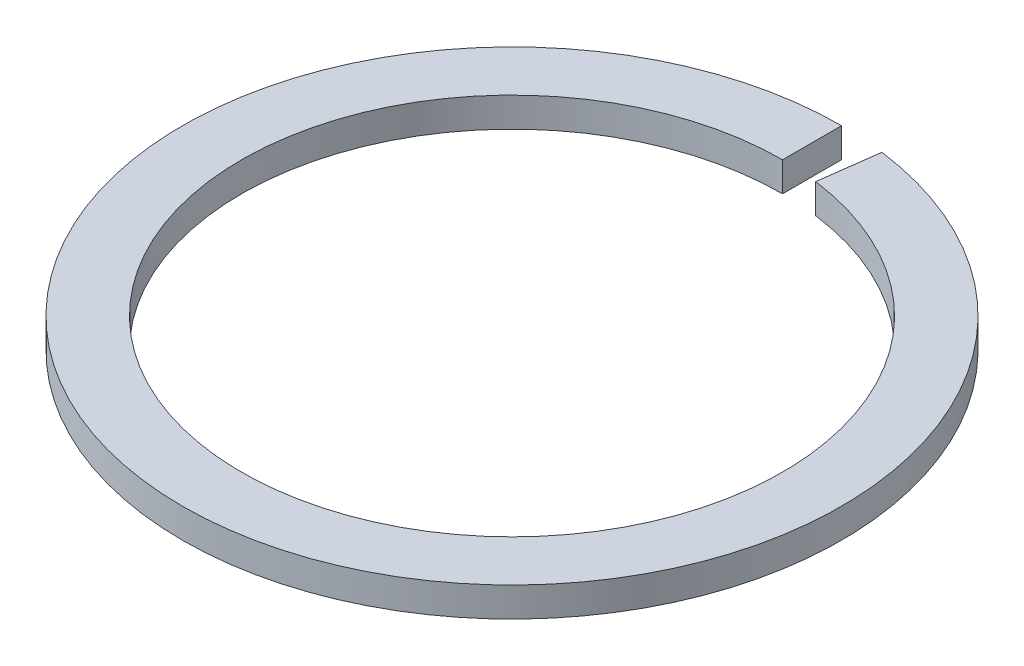
from build123d import *

# Parameters (mm, degrees)
SKETCH1_W = 1.5
SKETCH1_H = 0.75


with BuildPart() as part:
    # Sweep1: sweep along a path in Sketch2
    with BuildLine(Plane(origin=(0, 0, 0), x_dir=(1, 0, 0), z_dir=(0, 1, 0))) as sweep1_path:
        ThreePointArc((0, 0), (-0.501083152, -15.23351764), (1, -0.065858184))
    # Sketch1 → Sweep1 (sweep)
    with BuildSketch(Plane(origin=(0, 0, 0), x_dir=(0, 0, -1), z_dir=(1, 0, 0))):
        Rectangle(SKETCH1_W, SKETCH1_H)
    sweep(path=sweep1_path.line)


solid = part.part
